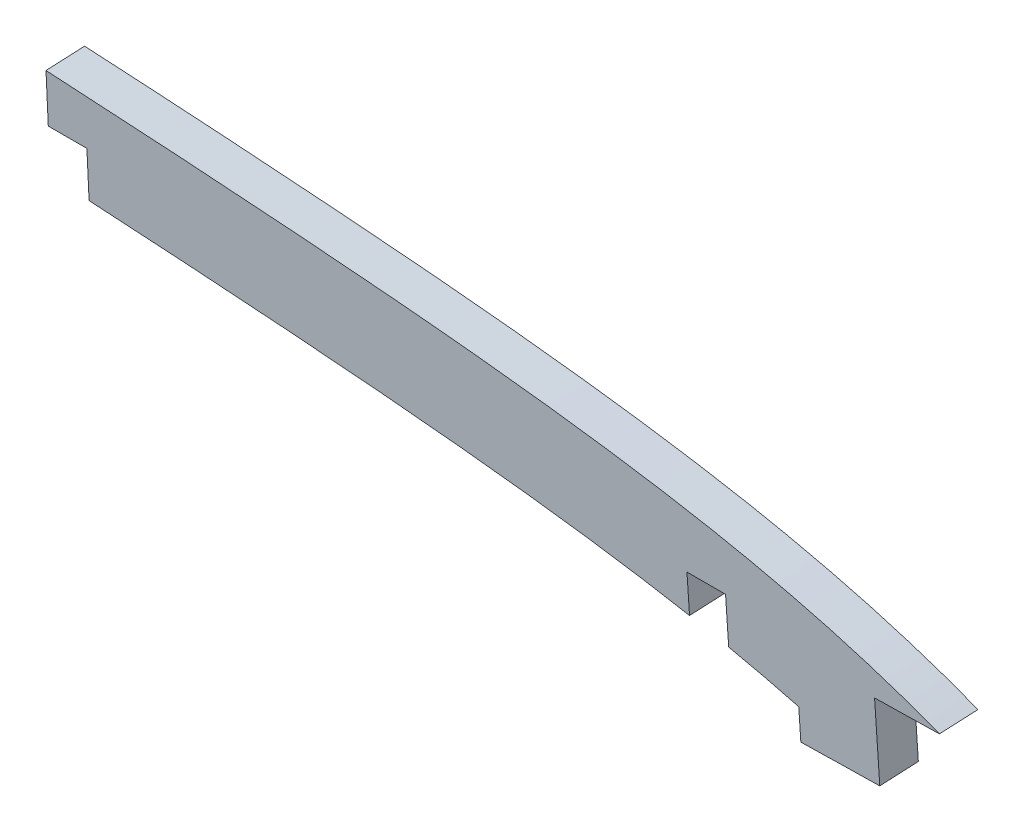
from build123d import *

# Parameters (mm, degrees)
BOSS_EXTRUDE1_DEPTH = 3.175
CUT_EXTRUDE1_DEPTH  = 346.234988545


# Read off the part's stored shape, not the designer's step: Boss-Extrude1
with BuildPart() as part:
    # Boss-Extrude1 outline → Boss-Extrude1 (new body)
    with BuildSketch(Plane(origin=(-0.009916987, 12.278576214, -263.860866814), x_dir=(-0.9999999992952415, -1.714878770133331e-06, 3.750435023264405e-05), z_dir=(-3.75435237541071e-05, 0.046483980928917014, -0.998919034810872))):
        with BuildLine():
            Line((-266.709915303, 57.648462135), (-266.709915303, 61.708027896))
            add(Edge.make_bspline(
                [(-266.709915303, 61.708027896), (-269.887584881, 61.52219978), (-273.064168518, 61.324064977), (-279.4149918, 60.901231504), (-282.58925463, 60.676795587), (-288.934509574, 60.190857567), (-292.10551029, 59.929452947), (-298.442167613, 59.346080292), (-301.607816437, 59.024024058), (-306.349701907, 58.466282245), (-307.929227861, 58.267873545), (-311.085515829, 57.839733129), (-312.663293034, 57.609828162), (-317.381062315, 56.863266021), (-320.506696952, 56.290451051), (-326.699623135, 54.920620881), (-329.766751467, 54.122978484), (-334.305076589, 52.686850178), (-335.807423356, 52.168067082), (-338.042782442, 51.320103283), (-338.784874555, 51.025814321), (-339.560385157, 50.703827374), (-339.597042887, 50.688573106), (-339.633692836, 50.67328778)],
                knots=[0, 0, 0, 0, 0.125, 0.125, 0.25, 0.25, 0.375, 0.375, 0.5, 0.5, 0.5625, 0.5625, 0.625, 0.625, 0.75, 0.75, 0.875, 0.875, 0.9375, 0.9375, 0.96875, 0.96875, 0.970300764, 0.970300764, 0.970300764, 0.970300764], degree=3))
            Line((-339.633692836, 50.67328778), (-334.298424209, 50.562597429))
            Line((-334.298424209, 50.562597429), (-334.430138757, 44.213963618))
            Line((-334.430138757, 44.213963618), (-327.936177051, 44.079233964))
            Line((-327.936177051, 44.079233964), (-327.883140614, 46.635587248))
            add(Edge.make_bspline(
                [(-327.883140614, 46.635587248), (-325.438031692, 47.326829824), (-320.133269542, 48.598331676), (-311.722176056, 50.061031972), (-299.81281744, 51.590536041), (-285.844187499, 52.790641789), (-274.800669007, 53.536749827), (-269.884915303, 53.838462135)],
                knots=[0.134029376, 0.134029376, 0.134029376, 0.134029376, 0.242575191, 0.363862787, 0.485150382, 0.727725573, 0.92246236, 0.92246236, 0.92246236, 0.92246236], degree=3))
            Line((-269.884915303, 53.838462135), (-269.884915303, 57.648462135))
            Line((-269.884915303, 57.648462135), (-266.709915303, 57.648462135))
        make_face()
    extrude(amount=BOSS_EXTRUDE1_DEPTH)

    # Sketch2 → Cut-Extrude1 (cut, through all)
    with BuildSketch(Plane(origin=(-0.010036187, 12.426162855, -267.03243475), x_dir=(-0.9999999992952414, -1.7148787712879688e-06, 3.750435025948783e-05), z_dir=(-3.7543523780975545e-05, 0.04648398092854075, -0.9989190348108895))):
        Polygon((-322.111723269, 51.877927034), (-322.190769005, 48.067927034), (-319.017135046, 48.002083929), (-318.936723269, 51.877927034), align=None)
    extrude(amount=-CUT_EXTRUDE1_DEPTH, mode=Mode.SUBTRACT)


solid = part.part
